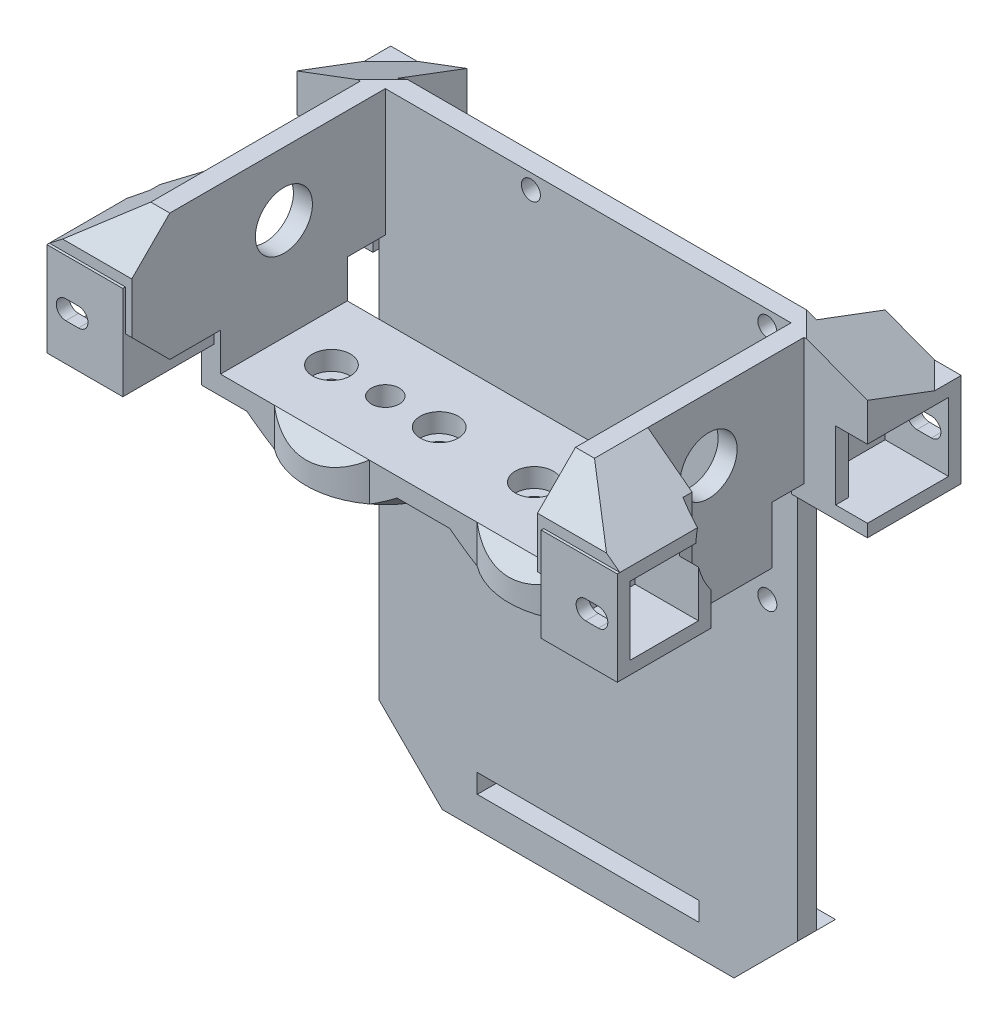
from build123d import *

# Parameters (mm, degrees)
SKETCH1_W            = 25
SKETCH1_H            = 20
BOSS_EXTRUDE1_DEPTH  = 3
SKETCH2_W            = 3
SKETCH2_H            = 20
BOSS_EXTRUDE2_DEPTH  = 40
SKETCH6_W            = 45
SKETCH6_H            = 20
BOSS_EXTRUDE3_DEPTH  = 3
SKETCH9_W            = 3
SKETCH9_H            = 20
BOSS_EXTRUDE4_DEPTH  = 40
SKETCH3_R            = 4.5
CUT_EXTRUDE1_DEPTH   = 83.758685345
CHAMFER1_SIZE        = 6
SKETCH17_W           = 14.8
SKETCH17_H           = 14.8
SKETCH17_W_2         = 10.8
SKETCH17_H_2         = 10.8
BOSS_EXTRUDE7_DEPTH  = 10
SKETCH18_W           = 14.8
SKETCH18_H           = 14.8
BOSS_EXTRUDE8_DEPTH  = 2
SKETCH21_W           = 14.8
SKETCH21_H           = 14.8
BOSS_EXTRUDE11_DEPTH = 2
BOSS_EXTRUDE12_REACH = 89.482
BOSS_EXTRUDE13_DEPTH = 7.6
CHAMFER4_SIZE        = 17
CHAMFER4_SIZE_2      = 9.039060338
CUT_EXTRUDE8_DEPTH   = 13
SKETCH26_R           = 12
CUT_EXTRUDE9_DEPTH   = 3
SKETCH27_W           = 2
SKETCH27_H           = 10.8
CUT_EXTRUDE10_DEPTH  = 3
CUT_EXTRUDE12_DEPTH  = 10
CUT_EXTRUDE13_START  = -10
CUT_EXTRUDE13_DEPTH  = 10
BOSS_EXTRUDE14_DEPTH = 3
SKETCH36_W           = 35
SKETCH36_H           = 20
SKETCH36_R           = 1.5
SKETCH36_R_2         = 2.2
BOSS_EXTRUDE15_DEPTH = 3
SKETCH37_R           = 12.5
SKETCH37_R_2         = 2.2
SKETCH37_R_3         = 1.5
BOSS_EXTRUDE16_DEPTH = 3
SKETCH38_R           = 3
CUT_EXTRUDE14_DEPTH  = 3
SKETCH39_R           = 3.7
CUT_EXTRUDE15_DEPTH  = 1.7
CHAMFER6_SIZE        = 3
CHAMFER7_SIZE        = 3
SKETCH40_W           = 2
SKETCH40_H           = 10.8
CUT_EXTRUDE16_DEPTH  = 2
SKETCH41_W           = 2
SKETCH41_H           = 10.8
CUT_EXTRUDE17_DEPTH  = 2
SKETCH42_W           = 66
SKETCH42_H           = 3
BOSS_EXTRUDE17_DEPTH = 66
SKETCH43_R           = 1.5
CUT_EXTRUDE18_DEPTH  = 10
SKETCH44_W           = 66
SKETCH44_H           = 2
BOSS_EXTRUDE18_DEPTH = 3
SKETCH45_W           = 35
SKETCH45_H           = 3
CUT_EXTRUDE19_DEPTH  = 3
SKETCH47_W           = 66
SKETCH47_H           = 3
BOSS_EXTRUDE19_DEPTH = 8
CHAMFER8_SIZE        = 10
SKETCH48_W           = 35
SKETCH48_H           = 3
CUT_EXTRUDE20_DEPTH  = 10
SKETCH49_W           = 2
SKETCH49_H           = 4
CUT_EXTRUDE21_DEPTH  = 5.32


with BuildPart() as part:
    # Sketch1 → Boss-Extrude1 (new body)
    with BuildSketch(Plane.XY):
        Rectangle(SKETCH1_W, SKETCH1_H)
    extrude(amount=BOSS_EXTRUDE1_DEPTH)

    # Sketch2 → Boss-Extrude2 (add)
    with BuildSketch(Plane.XY.offset(3)):
        with Locations((-11, 0)):
            Rectangle(SKETCH2_W, SKETCH2_H)
    extrude(amount=BOSS_EXTRUDE2_DEPTH)

    # Sketch6 → Boss-Extrude3 (add)
    with BuildSketch(Plane(origin=(0, 0, 0), x_dir=(-1, 0, 0), z_dir=(0, 0, -1))):
        with Locations((-35, 0)):
            Rectangle(SKETCH6_W, SKETCH6_H)
    extrude(amount=-BOSS_EXTRUDE3_DEPTH)

    # Sketch9 → Boss-Extrude4 (add)
    with BuildSketch(Plane.XY.offset(3)):
        with Locations((56, 0)):
            Rectangle(SKETCH9_W, SKETCH9_H)
    extrude(amount=BOSS_EXTRUDE4_DEPTH)

    # Sketch3 → Cut-Extrude1 (cut, through all)
    with BuildSketch(Plane.ZY.offset(12.5)):
        with Locations(Location((19, 0, 0), (0, 0, 270))):
            Circle(SKETCH3_R)
    extrude(amount=-CUT_EXTRUDE1_DEPTH, mode=Mode.SUBTRACT)

    # Chamfer1
    chamfer1_edges = [part.edges().sort_by_distance(p)[0] for p in [
        (-11, -10, 43),
        (-11, 10, 43),
        (56, -10, 43),
        (56, 10, 43),
    ]]
    chamfer(chamfer1_edges, length=CHAMFER1_SIZE)

    # Sketch17 → Boss-Extrude7 (add)
    # profile 1 of 2: a face of its own
    with BuildSketch(Plane(origin=(57.5, 0, 0), x_dir=(0, 0, -1), z_dir=(1, 0, 0))):
        with Locations((3.445401219, -5)):
            Rectangle(SKETCH17_W, SKETCH17_H)
        with Locations((3.445401219, -5)):
            Rectangle(SKETCH17_W_2, SKETCH17_H_2, mode=Mode.SUBTRACT)
    # profile 2 of 2: a face of its own
    with BuildSketch(Plane(origin=(57.5, 0, 0), x_dir=(0, 0, -1), z_dir=(1, 0, 0))):
        with Locations((-36.004598781, -5)):
            Rectangle(SKETCH17_W, SKETCH17_H)
        with Locations((-36.004598781, -5)):
            Rectangle(SKETCH17_W_2, SKETCH17_H_2, mode=Mode.SUBTRACT)
    extrude(amount=BOSS_EXTRUDE7_DEPTH)

    # Sketch18 → Boss-Extrude8 (add)
    with BuildSketch(Plane.ZY.offset(-57.5)):
        with Locations((-3.445401219, -5)):
            Rectangle(SKETCH18_W, SKETCH18_H)
    extrude(amount=BOSS_EXTRUDE8_DEPTH)

    # Sketch21 → Boss-Extrude11 (add)
    with BuildSketch(Plane.ZY.offset(-57.5)):
        with Locations((36.004598781, -5)):
            Rectangle(SKETCH21_W, SKETCH21_H)
    extrude(amount=BOSS_EXTRUDE11_DEPTH)

    # Boss-Extrude12: up to this face of the body (flat: up to its plane)
    boss_extrude12_end = Plane(part.part.faces().sort_by_distance((62.311518325, -5.194764398, 28.604598781))[0])
    # Sketch22 → Boss-Extrude12 (add, up to the picked face)
    with BuildSketch(Plane.XY.offset(43.404598781), mode=Mode.PRIVATE) as boss_extrude12_sk1:
        Polygon((57.5, 2.4), (57.5, 10), (67.5, 2.4), align=None)
    boss_extrude12_tool1 = split(extrude(boss_extrude12_sk1.sketch, amount=-BOSS_EXTRUDE12_REACH, mode=Mode.PRIVATE), bisect_by=boss_extrude12_end, keep=Keep.BOTH, mode=Mode.PRIVATE)
    add(boss_extrude12_tool1.solids().sort_by(Axis((60.833333, 4.933333, 43.404599), (0, 0, -1)))[0])

    # Sketch23 → Boss-Extrude13 (add)
    with BuildSketch(Plane(origin=(0, 2.4, 0), x_dir=(1, 0, 0), z_dir=(0, 1, 0))):
        Polygon((55.5, 0), (57.5, 0), (57.5, -3.954598781), (67.5, -3.954598781), (67.5, 10.492881323), (67.147480104, 10.845401219), (55.5, 10.845401219), align=None)
    extrude(amount=BOSS_EXTRUDE13_DEPTH)

    # Chamfer4
    # the kernel refuses this chamfer: 17, 9.039060338 mm, written as the material it takes off along each edge
    with BuildSketch(Plane(origin=(98.618530871, 10, 20.625649548), x_dir=(-0.7071067811865565, 0, 0.7071067811865387), z_dir=(-0.7071067811865386, 0, -0.7071067811865565))) as chamfer4_piece_1_section:
        Polygon((CHAMFER4_SIZE, 0), (0, -CHAMFER4_SIZE_2), (0, 0), align=None)
    chamfer4_piece_1 = extrude(amount=88.515035216, mode=Mode.PRIVATE)
    chamfer4_piece_1 = split(chamfer4_piece_1, bisect_by=Plane(origin=(98.618530871, 2.4, 20.625649548), z_dir=(0, 1, 0)), keep=Keep.TOP, mode=Mode.PRIVATE)
    add(chamfer4_piece_1, mode=Mode.SUBTRACT)

    # Sketch24 → Cut-Extrude8 (cut)
    with BuildSketch(Plane.ZY.offset(-57.5)):
        Polygon((37, 10), (43.404598781, 10), (43.404598781, 2.4), (43, 2.4), (43, 4), align=None)
    extrude(amount=-CUT_EXTRUDE8_DEPTH, mode=Mode.SUBTRACT)

    # Sketch26 → Cut-Extrude9 (cut)
    with BuildSketch(Plane(origin=(67.5, 0, 0), x_dir=(0, 0, -1), z_dir=(1, 0, 0))):
        with Locations((-19, 0)):
            Circle(SKETCH26_R)
    extrude(amount=-CUT_EXTRUDE9_DEPTH, mode=Mode.SUBTRACT)

    # Mirror3: read off the stored shape, not the designer's step
    # Mirror3
    split(bisect_by=Plane.ZY.offset(-22.5), keep=Keep.BOTTOM)

    # Mirror3 2: part across plane


with BuildPart() as part_1:
    add(part.part)
    add(part.part.mirror(Plane.ZY.offset(-22.5)))

    # Sketch27 → Cut-Extrude10 (cut)
    with BuildSketch(Plane.ZY.offset(22.5)):
        with Locations((2.954598781, -5)):
            Rectangle(SKETCH27_W, SKETCH27_H)
    cut_extrude10 = extrude(amount=-CUT_EXTRUDE10_DEPTH, mode=Mode.SUBTRACT)

    # Mirror4: Cut-Extrude10 across plane
    add(cut_extrude10.mirror(Plane.ZY.offset(-22.5)), mode=Mode.SUBTRACT)

    # Sketch32 → Cut-Extrude12 (cut)
    with BuildSketch(Plane(origin=(0, 0, -10.845401219), x_dir=(-1, 0, 0), z_dir=(0, 0, -1))):
        with BuildLine():
            Line((19.790168373, -6.5), (17.5, -6.5))
            ThreePointArc((17.5, -6.5), (16, -5), (17.5, -3.5))
            Line((17.5, -3.5), (19.790168373, -3.5))
            ThreePointArc((19.790168373, -3.5), (21.290168373, -5), (19.790168373, -6.5))
        make_face()
        with BuildLine():
            Line((-64.790168373, -6.5), (-62.5, -6.5))
            ThreePointArc((-62.5, -6.5), (-61, -5), (-62.5, -3.5))
            Line((-62.5, -3.5), (-64.790168373, -3.5))
            ThreePointArc((-64.790168373, -3.5), (-66.290168373, -5), (-64.790168373, -6.5))
        make_face()
    extrude(amount=-CUT_EXTRUDE12_DEPTH, mode=Mode.SUBTRACT)

    # Sketch33 → Cut-Extrude13 (cut)
    with BuildSketch(Plane.XY.offset(43.404598781).offset(CUT_EXTRUDE13_START)):
        with BuildLine():
            Line((62.5, -3.5), (64.5, -3.5))
            ThreePointArc((64.5, -3.5), (66, -5), (64.5, -6.5))
            Line((64.5, -6.5), (62.5, -6.5))
            ThreePointArc((62.5, -6.5), (61, -5), (62.5, -3.5))
        make_face()
        with BuildLine():
            Line((-17.5, -6.5), (-19.5, -6.5))
            ThreePointArc((-19.5, -6.5), (-21, -5), (-19.5, -3.5))
            Line((-19.5, -3.5), (-17.5, -3.5))
            ThreePointArc((-17.5, -3.5), (-16, -5), (-17.5, -6.5))
        make_face()
    extrude(amount=CUT_EXTRUDE13_DEPTH, mode=Mode.SUBTRACT)

    # Sketch35 → Boss-Extrude14 (add)
    with BuildSketch(Plane(origin=(-9.5, 0, 0), x_dir=(0, 0, -1), z_dir=(1, 0, 0))):
        Polygon((-19, -16), (-29, -16), (-29, -10), (-9, -10), (-9, -16), align=None)
    boss_extrude14 = extrude(amount=-BOSS_EXTRUDE14_DEPTH)

    # Sketch36 → Boss-Extrude15 (add)
    with BuildSketch(Plane.XZ.offset(16)):
        with Locations((5, 19)):
            Rectangle(SKETCH36_W, SKETCH36_H)
        with Locations((15, 19)):
            Circle(SKETCH36_R, mode=Mode.SUBTRACT)
        with Locations((-2, 19)):
            Circle(SKETCH36_R, mode=Mode.SUBTRACT)
        with Locations((6.5, 19)):
            Circle(SKETCH36_R_2, mode=Mode.SUBTRACT)
    boss_extrude15 = extrude(amount=BOSS_EXTRUDE15_DEPTH)

    # Sketch37 → Boss-Extrude16 (add)
    with BuildSketch(Plane.XZ.offset(19)):
        with Locations(Location((6.5, 19, 0), (0, 0, 126.869897646))):
            Circle(SKETCH37_R)
        with Locations((6.5, 19)):
            Circle(SKETCH37_R_2, mode=Mode.SUBTRACT)
        with Locations((-2, 19)):
            Circle(SKETCH37_R_3, mode=Mode.SUBTRACT)
        with Locations((15, 19)):
            Circle(SKETCH37_R_3, mode=Mode.SUBTRACT)
    boss_extrude16 = extrude(amount=BOSS_EXTRUDE16_DEPTH)

    # Sketch38 → Cut-Extrude14 (cut)
    with BuildSketch(Plane(origin=(0, -16, 0), x_dir=(1, 0, 0), z_dir=(0, 1, 0))):
        with Locations(Location((-2, -19, 0), (0, 0, 180))):
            Circle(SKETCH38_R)
        with Locations(Location((15, -19, 0), (0, 0, 180))):
            Circle(SKETCH38_R)
    cut_extrude14 = extrude(amount=-CUT_EXTRUDE14_DEPTH, mode=Mode.SUBTRACT)

    # Sketch39 → Cut-Extrude15 (cut)
    with BuildSketch(Plane(origin=(0, -22, 0), x_dir=(-1, 0, 0), z_dir=(0, -1, 0))):
        with Locations(Location((-6.5, -19, 0), (0, 0, 180))):
            Circle(SKETCH39_R)
    cut_extrude15 = extrude(amount=-CUT_EXTRUDE15_DEPTH, mode=Mode.SUBTRACT)

    # Mirror5: Boss-Extrude14, Boss-Extrude15, Boss-Extrude16, Cut-Extrude14, Cut-Extrude15 across plane
    add(boss_extrude14.mirror(Plane(origin=(22.5, -19, 0), x_dir=(0, 0, 1), z_dir=(1, 0, 0))))
    add(boss_extrude15.mirror(Plane(origin=(22.5, -19, 0), x_dir=(0, 0, 1), z_dir=(1, 0, 0))))
    add(boss_extrude16.mirror(Plane(origin=(22.5, -19, 0), x_dir=(0, 0, 1), z_dir=(1, 0, 0))))
    add(cut_extrude14.mirror(Plane(origin=(22.5, -19, 0), x_dir=(0, 0, 1), z_dir=(1, 0, 0))), mode=Mode.SUBTRACT)
    add(cut_extrude15.mirror(Plane(origin=(22.5, -19, 0), x_dir=(0, 0, 1), z_dir=(1, 0, 0))), mode=Mode.SUBTRACT)

    # Chamfer6
    # the kernel refuses this chamfer: 3 mm, written as the material it adds along each edge
    with BuildSketch(Plane(origin=(6.5, -19, 19), x_dir=(0.02594862310488829, 0, -0.9996632777885565), z_dir=(-0.9996632777885565, 0, -0.02594862310488829))) as chamfer6_piece_1_section:
        Polygon((12.5 + CHAMFER6_SIZE, 0), (12.5, CHAMFER6_SIZE), (12.5, 0), align=None)
    chamfer6_piece_1 = revolve(axis=Axis((6.5, -19, 19), (0, -1, 0)), revolution_arc=177.026173032, mode=Mode.PRIVATE)
    chamfer6_piece_1 = split(chamfer6_piece_1, bisect_by=Plane(origin=(6.5, -19, 29), z_dir=(0, 0, -1)), keep=Keep.TOP, mode=Mode.PRIVATE)
    chamfer6_piece_1 = split(chamfer6_piece_1, bisect_by=Plane(origin=(6.5, -19, 9), z_dir=(0, 0, 1)), keep=Keep.TOP, mode=Mode.PRIVATE)
    add(chamfer6_piece_1)
    with BuildSketch(Plane(origin=(6.5, -19, 19), x_dir=(-0.02594862310756071, 0, 0.9996632777884871), z_dir=(0.9996632777884871, 0, 0.02594862310756071))) as chamfer6_piece_2_section:
        Polygon((12.5 + CHAMFER6_SIZE, 0), (12.5, CHAMFER6_SIZE), (12.5, 0), align=None)
    chamfer6_piece_2 = revolve(axis=Axis((6.5, -19, 19), (0, -1, 0)), revolution_arc=177.026173032, mode=Mode.PRIVATE)
    chamfer6_piece_2 = split(chamfer6_piece_2, bisect_by=Plane(origin=(6.5, -19, 29), z_dir=(0, 0, -1)), keep=Keep.TOP, mode=Mode.PRIVATE)
    chamfer6_piece_2 = split(chamfer6_piece_2, bisect_by=Plane(origin=(6.5, -19, 9), z_dir=(0, 0, 1)), keep=Keep.TOP, mode=Mode.PRIVATE)
    add(chamfer6_piece_2)
    with BuildSketch(Plane(origin=(38.5, -19, 19), x_dir=(-0.02594862310490669, 0, -0.9996632777885559), z_dir=(0.9996632777885559, 0, -0.02594862310490669))) as chamfer6_piece_3_section:
        Polygon((12.5 + CHAMFER6_SIZE, 0), (12.5, -CHAMFER6_SIZE), (12.5, 0), align=None)
    chamfer6_piece_3 = revolve(axis=Axis((38.5, -19, 19), (0, 1, 0)), revolution_arc=177.026173032, mode=Mode.PRIVATE)
    chamfer6_piece_3 = split(chamfer6_piece_3, bisect_by=Plane(origin=(38.5, -19, 29), z_dir=(0, 0, -1)), keep=Keep.TOP, mode=Mode.PRIVATE)
    chamfer6_piece_3 = split(chamfer6_piece_3, bisect_by=Plane(origin=(38.5, -19, 9), z_dir=(0, 0, 1)), keep=Keep.TOP, mode=Mode.PRIVATE)
    add(chamfer6_piece_3)
    with BuildSketch(Plane(origin=(38.5, -19, 19), x_dir=(0.025948623107560718, 0, 0.9996632777884871), z_dir=(-0.9996632777884871, 0, 0.025948623107560718))) as chamfer6_piece_4_section:
        Polygon((12.5 + CHAMFER6_SIZE, 0), (12.5, -CHAMFER6_SIZE), (12.5, 0), align=None)
    chamfer6_piece_4 = revolve(axis=Axis((38.5, -19, 19), (0, 1, 0)), revolution_arc=177.026173032, mode=Mode.PRIVATE)
    chamfer6_piece_4 = split(chamfer6_piece_4, bisect_by=Plane(origin=(38.5, -19, 29), z_dir=(0, 0, -1)), keep=Keep.TOP, mode=Mode.PRIVATE)
    chamfer6_piece_4 = split(chamfer6_piece_4, bisect_by=Plane(origin=(38.5, -19, 9), z_dir=(0, 0, 1)), keep=Keep.TOP, mode=Mode.PRIVATE)
    add(chamfer6_piece_4)

    # Chamfer7
    # the kernel refuses this chamfer: 3 mm, written as the material it adds along each edge
    with BuildSketch(Plane(origin=(23.284951036, -19, 29), x_dir=(0, 1, 0), z_dir=(1, 0, 0))) as chamfer7_piece_1_section:
        Polygon((CHAMFER7_SIZE, 0), (0, CHAMFER7_SIZE), (0, 0), align=None)
    chamfer7_piece_1 = extrude(amount=30.430097928, mode=Mode.PRIVATE)
    chamfer7_piece_1 = chamfer7_piece_1 & Plane(origin=(38.5, -19, 19), x_dir=(0.6000000000021779, 0, 0.7999999999983666), z_dir=(0, 1, 0)) * Cylinder(12.5, 73, mode=Mode.PRIVATE)
    add(chamfer7_piece_1)
    with BuildSketch(Plane(origin=(53.715048964, -19, 9), x_dir=(0, 1, 0), z_dir=(-1, 0, 0))) as chamfer7_piece_2_section:
        Polygon((CHAMFER7_SIZE, 0), (0, CHAMFER7_SIZE), (0, 0), align=None)
    chamfer7_piece_2 = extrude(amount=30.430097928, mode=Mode.PRIVATE)
    chamfer7_piece_2 = chamfer7_piece_2 & Plane(origin=(38.5, -19, 19), x_dir=(0.6000000000021779, 0, 0.7999999999983666), z_dir=(0, 1, 0)) * Cylinder(12.5, 73, mode=Mode.PRIVATE)
    add(chamfer7_piece_2)
    with BuildSketch(Plane(origin=(21.715048964, -19, 29), x_dir=(0, 1, 0), z_dir=(-1, 0, 0))) as chamfer7_piece_3_section:
        Polygon((CHAMFER7_SIZE, 0), (0, -CHAMFER7_SIZE), (0, 0), align=None)
    chamfer7_piece_3 = extrude(amount=30.430097928, mode=Mode.PRIVATE)
    chamfer7_piece_3 = chamfer7_piece_3 & Plane(origin=(6.5, -19, 19), x_dir=(-0.6000000000021777, 0, 0.7999999999983668), z_dir=(0, 1, 0)) * Cylinder(12.5, 73, mode=Mode.PRIVATE)
    add(chamfer7_piece_3)
    with BuildSketch(Plane(origin=(-8.715048964, -19, 9), x_dir=(0, 1, 0), z_dir=(1, 0, 0))) as chamfer7_piece_4_section:
        Polygon((CHAMFER7_SIZE, 0), (0, -CHAMFER7_SIZE), (0, 0), align=None)
    chamfer7_piece_4 = extrude(amount=30.430097928, mode=Mode.PRIVATE)
    chamfer7_piece_4 = chamfer7_piece_4 & Plane(origin=(6.5, -19, 19), x_dir=(-0.6000000000021777, 0, 0.7999999999983668), z_dir=(0, 1, 0)) * Cylinder(12.5, 73, mode=Mode.PRIVATE)
    add(chamfer7_piece_4)

    # Sketch40 → Cut-Extrude16 (cut)
    with BuildSketch(Plane(origin=(64.5, 0, 0), x_dir=(0, 0, -1), z_dir=(1, 0, 0))):
        with Locations((-2.954598781, -5)):
            Rectangle(SKETCH40_W, SKETCH40_H)
    extrude(amount=-CUT_EXTRUDE16_DEPTH, mode=Mode.SUBTRACT)

    # Sketch41 → Cut-Extrude17 (cut)
    with BuildSketch(Plane.ZY.offset(19.5)):
        with Locations((2.954598781, -5)):
            Rectangle(SKETCH41_W, SKETCH41_H)
    extrude(amount=-CUT_EXTRUDE17_DEPTH, mode=Mode.SUBTRACT)

    # Sketch42 → Boss-Extrude17 (add)
    with BuildSketch(Plane(origin=(0, -10, 0), x_dir=(-1, 0, 0), z_dir=(0, -1, 0))):
        with Locations((-22.5, -1.5)):
            Rectangle(SKETCH42_W, SKETCH42_H)
    extrude(amount=BOSS_EXTRUDE17_DEPTH)

    # Sketch43 → Cut-Extrude18 (cut)
    with BuildSketch(Plane(origin=(0, 0, 0), x_dir=(-1, 0, 0), z_dir=(0, 0, -1))):
        with Locations((-13.46104456, -29.65852229)):
            Circle(SKETCH43_R)
        with Locations((-50.76104456, -29.65852229)):
            Circle(SKETCH43_R)
        with Locations((-50.76104456, 7.64147771)):
            Circle(SKETCH43_R)
        with Locations((-13.46104456, 7.64147771)):
            Circle(SKETCH43_R)
    extrude(amount=-CUT_EXTRUDE18_DEPTH, mode=Mode.SUBTRACT)

    # Sketch44 → Boss-Extrude18 (add)
    with BuildSketch(Plane(origin=(0, 0, 0), x_dir=(-1, 0, 0), z_dir=(0, 0, -1))):
        with Locations((-22.5, -75)):
            Rectangle(SKETCH44_W, SKETCH44_H)
    extrude(amount=BOSS_EXTRUDE18_DEPTH)

    # Sketch45 → Cut-Extrude19 (cut)
    with BuildSketch(Plane(origin=(0, 0, 0), x_dir=(-1, 0, 0), z_dir=(0, 0, -1))):
        with Locations((-21.252060542, -34.15852229)):
            Rectangle(SKETCH45_W, SKETCH45_H)
    extrude(amount=-CUT_EXTRUDE19_DEPTH, mode=Mode.SUBTRACT)

    # Sketch47 → Boss-Extrude19 (add)
    with BuildSketch(Plane.XZ.offset(76)):
        with Locations((22.5, 1.5)):
            Rectangle(SKETCH47_W, SKETCH47_H)
    extrude(amount=BOSS_EXTRUDE19_DEPTH)

    # Chamfer8
    chamfer8_edges = [part_1.edges().sort_by_distance(p)[0] for p in [
        (55.5, -84, 1.5),
        (-10.5, -84, 1.5),
    ]]
    chamfer(chamfer8_edges, length=CHAMFER8_SIZE - 0.0001)  # a hair under: the kernel refuses the full size

    # Sketch48 → Cut-Extrude20 (cut)
    with BuildSketch(Plane(origin=(0, 0, 0), x_dir=(-1, 0, 0), z_dir=(0, 0, -1))):
        with Locations((-22.5, -77.662469684)):
            Rectangle(SKETCH48_W, SKETCH48_H)
    extrude(amount=-CUT_EXTRUDE20_DEPTH, mode=Mode.SUBTRACT)

    # Sketch49 → Cut-Extrude21 (cut)
    with BuildSketch(Plane(origin=(0, 0, 0), x_dir=(-1, 0, 0), z_dir=(0, 0, -1))):
        with Locations((-6.557386324, -26.741673731)):
            Rectangle(SKETCH49_W, SKETCH49_H)
        with Locations((7.530160854, -26.741673731)):
            Rectangle(SKETCH49_W, SKETCH49_H)
    extrude(amount=-CUT_EXTRUDE21_DEPTH, mode=Mode.SUBTRACT)


solid = part_1.part
